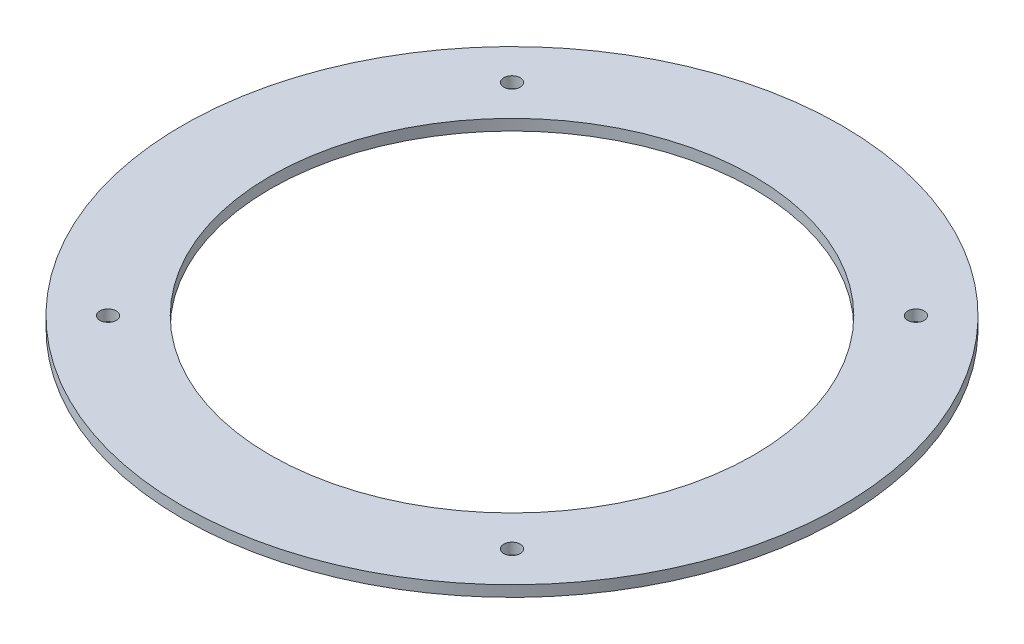
from build123d import *

# Parameters (mm, degrees)
SKETCH_1_R             = 60
SM_BASE_FLANGE_1_DEPTH = 2
CUT_EXTRUDE_2_REACH    = 86.876
SKETCH_7_R             = 44
CUT_EXTRUDE_1_REACH    = 86.876
SKETCH_6_R             = 1.5


# Sheet-metal steps are written as plain solids
with BuildPart() as part:
    # Sketch 1 → 基体-法兰1 (new body)
    with BuildSketch(Plane(origin=(0, 0, 0), x_dir=(1, 0, 0), z_dir=(0, 1, 0))):
        with Locations(Location((0, 0, 0), (0, 0, 270))):
            Circle(SKETCH_1_R)
    extrude(amount=-SM_BASE_FLANGE_1_DEPTH)

    # 草图7 → 切除-拉伸2 (cut, up to next)
    with BuildSketch(Plane(origin=(0, 0, 0), x_dir=(1, 0, 0), z_dir=(0, 1, 0)), mode=Mode.PRIVATE) as cut_extrude_2_sk1:
        with Locations(Location((0, 0, 0), (0, 0, 270))):
            Circle(SKETCH_7_R)
    cut_extrude_2_tool1 = extrude(cut_extrude_2_sk1.sketch, amount=-CUT_EXTRUDE_2_REACH, mode=Mode.PRIVATE) & part.part
    add(cut_extrude_2_tool1.solids().sort_by_distance((0, 0, 0))[0], mode=Mode.SUBTRACT)

    # 草图6 → 切除-拉伸1 (cut, up to next)
    with BuildSketch(Plane(origin=(0, 0, 0), x_dir=(1, 0, 0), z_dir=(0, 1, 0)), mode=Mode.PRIVATE) as cut_extrude_1_sk1:
        with Locations(Location((-36.769552622, -36.769552622, 0), (0, 0, 270))):
            Circle(SKETCH_6_R)
    cut_extrude_1_tool1 = extrude(cut_extrude_1_sk1.sketch, amount=-CUT_EXTRUDE_1_REACH, mode=Mode.PRIVATE) & part.part
    # 草图6 → 切除-拉伸1 (cut, up to next)
    with BuildSketch(Plane(origin=(0, 0, 0), x_dir=(1, 0, 0), z_dir=(0, 1, 0)), mode=Mode.PRIVATE) as cut_extrude_1_sk2:
        with Locations(Location((-36.769552622, 36.769552622, 0), (0, 0, 270))):
            Circle(SKETCH_6_R)
    cut_extrude_1_tool2 = extrude(cut_extrude_1_sk2.sketch, amount=-CUT_EXTRUDE_1_REACH, mode=Mode.PRIVATE) & part.part
    # 草图6 → 切除-拉伸1 (cut, up to next)
    with BuildSketch(Plane(origin=(0, 0, 0), x_dir=(1, 0, 0), z_dir=(0, 1, 0)), mode=Mode.PRIVATE) as cut_extrude_1_sk3:
        with Locations(Location((36.769552622, 36.769552622, 0), (0, 0, 270))):
            Circle(SKETCH_6_R)
    cut_extrude_1_tool3 = extrude(cut_extrude_1_sk3.sketch, amount=-CUT_EXTRUDE_1_REACH, mode=Mode.PRIVATE) & part.part
    # 草图6 → 切除-拉伸1 (cut, up to next)
    with BuildSketch(Plane(origin=(0, 0, 0), x_dir=(1, 0, 0), z_dir=(0, 1, 0)), mode=Mode.PRIVATE) as cut_extrude_1_sk4:
        with Locations(Location((36.769552622, -36.769552622, 0), (0, 0, 270))):
            Circle(SKETCH_6_R)
    cut_extrude_1_tool4 = extrude(cut_extrude_1_sk4.sketch, amount=-CUT_EXTRUDE_1_REACH, mode=Mode.PRIVATE) & part.part
    add(cut_extrude_1_tool1.solids().sort_by_distance((-36.769553, 0, 36.769553))[0], mode=Mode.SUBTRACT)
    add(cut_extrude_1_tool2.solids().sort_by_distance((-36.769553, 0, -36.769553))[0], mode=Mode.SUBTRACT)
    add(cut_extrude_1_tool3.solids().sort_by_distance((36.769553, 0, -36.769553))[0], mode=Mode.SUBTRACT)
    add(cut_extrude_1_tool4.solids().sort_by_distance((36.769553, 0, 36.769553))[0], mode=Mode.SUBTRACT)


solid = part.part
